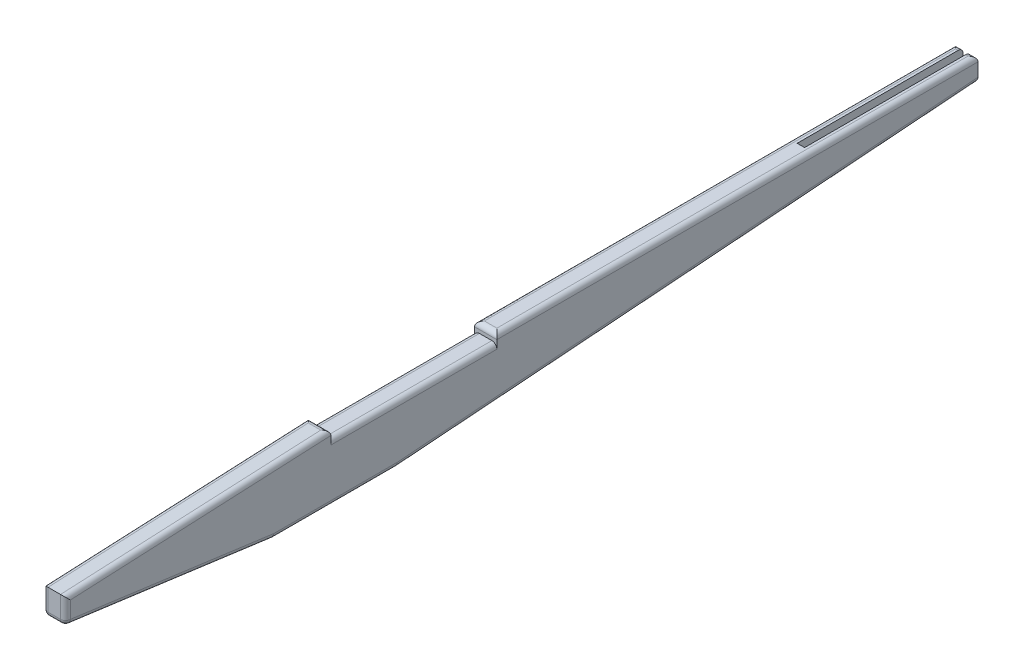
from build123d import *

# Parameters (mm, degrees)
BOSS_EXTRUDE1_DEPTH = 13.5
SKETCH2_W           = 100
SKETCH2_H           = 5
CUT_EXTRUDE1_DEPTH  = 552.61784779
SKETCH3_W           = 4.5
SKETCH3_H           = 100
CUT_EXTRUDE2_DEPTH  = 5
FILLET1_R           = 3


with BuildPart() as part:
    # Sketch1 → Boss-Extrude1 (new body)
    with BuildSketch(Plane(origin=(0, 0, 0), x_dir=(0, 0, -1), z_dir=(1, 0, 0))):
        Polygon((0, 16.9), (0, 32.5), (160, 40), (550, 40), (550, 26), (200, 0), (125.3, 0), align=None)
    extrude(amount=BOSS_EXTRUDE1_DEPTH)

    # Sketch2 → Cut-Extrude1 (cut, through all)
    with BuildSketch(Plane(origin=(13.5, 0, 0), x_dir=(0, 0, -1), z_dir=(1, 0, 0))):
        with Locations((210, 37.5)):
            Rectangle(SKETCH2_W, SKETCH2_H)
    extrude(amount=-CUT_EXTRUDE1_DEPTH, mode=Mode.SUBTRACT)

    # Sketch3 → Cut-Extrude2 (cut)
    with BuildSketch(Plane(origin=(0, 40, 0), x_dir=(1, 0, 0), z_dir=(0, 1, 0))):
        with Locations((6.75, 500)):
            Rectangle(SKETCH3_W, SKETCH3_H)
    extrude(amount=-CUT_EXTRUDE2_DEPTH, mode=Mode.SUBTRACT)

    # Fillet1
    # the kernel refuses this fillet: 3 mm, written as the material it takes off along each edge
    with BuildSketch(Plane(origin=(10.5, 3, -125.501402614), x_dir=(0, -1, 0), z_dir=(1, 0, 0))) as fillet1_piece_1_section:
        Polygon((0, 0), (FILLET1_R, 0), (FILLET1_R, -FILLET1_R * 0.0671342046123), (FILLET1_R * 0.991026440985, -FILLET1_R * 0.133665976478), align=None)
    fillet1_piece_1 = extrude(amount=FILLET1_R, mode=Mode.PRIVATE)
    fillet1_piece_1 = fillet1_piece_1 - Plane(origin=(10.5, 3, -125.501402614), x_dir=(0, 0.9977540881864227, -0.0669834271091007), z_dir=(1, 0, 0)) * Sphere(FILLET1_R, mode=Mode.PRIVATE)
    add(fillet1_piece_1, mode=Mode.SUBTRACT)
    with BuildSketch(Plane(origin=(10.5, 19.522535548, -3), x_dir=(0, 0, 1), z_dir=(1, 0, 0))) as fillet1_piece_2_section:
        Polygon((0, 0), (FILLET1_R, 0), (FILLET1_R, FILLET1_R * 0.874178516025), (FILLET1_R * 0.133665976478, FILLET1_R * 0.991026440985), align=None)
    fillet1_piece_2 = extrude(amount=FILLET1_R, mode=Mode.PRIVATE)
    fillet1_piece_2 = fillet1_piece_2 - Plane(origin=(10.5, 19.522535548, -3), x_dir=(0, 0.6581542461772603, -0.75288311724918), z_dir=(1, 0, 0)) * Sphere(FILLET1_R, mode=Mode.PRIVATE)
    add(fillet1_piece_2, mode=Mode.SUBTRACT)
    with BuildSketch(Plane(origin=(3, 3, -125.501402614), x_dir=(0, -1, 0), z_dir=(-1, 0, 0))) as fillet1_piece_3_section:
        Polygon((0, 0), (FILLET1_R, 0), (FILLET1_R, FILLET1_R * 0.0671342046123), (FILLET1_R * 0.991026440985, FILLET1_R * 0.133665976478), align=None)
    fillet1_piece_3 = extrude(amount=FILLET1_R, mode=Mode.PRIVATE)
    fillet1_piece_3 = fillet1_piece_3 - Plane(origin=(3, 3, -125.501402614), x_dir=(0, 0.9977540881864227, -0.0669834271091007), z_dir=(-1, 0, 0)) * Sphere(FILLET1_R, mode=Mode.PRIVATE)
    add(fillet1_piece_3, mode=Mode.SUBTRACT)
    with BuildSketch(Plane(origin=(3, 19.522535548, -3), x_dir=(0, 0, 1), z_dir=(-1, 0, 0))) as fillet1_piece_4_section:
        Polygon((0, 0), (FILLET1_R, 0), (FILLET1_R, -FILLET1_R * 0.874178516025), (FILLET1_R * 0.133665976478, -FILLET1_R * 0.991026440985), align=None)
    fillet1_piece_4 = extrude(amount=FILLET1_R, mode=Mode.PRIVATE)
    fillet1_piece_4 = fillet1_piece_4 - Plane(origin=(3, 19.522535548, -3), x_dir=(0, 0.6581542461772603, -0.75288311724918), z_dir=(-1, 0, 0)) * Sphere(FILLET1_R, mode=Mode.PRIVATE)
    add(fillet1_piece_4, mode=Mode.SUBTRACT)
    with BuildSketch(Plane(origin=(0, 32.148823103, 7.491773808), x_dir=(1, 0, 0), z_dir=(0, 0.046823586298586156, -0.998903174369838))) as fillet1_piece_5:
        with BuildLine():
            CenterArc((FILLET1_R, FILLET1_R), FILLET1_R, 180, 90)
            Line((0, FILLET1_R), (0, 0))
            Line((0, 0), (FILLET1_R, 0))
        make_face()
    extrude(amount=175.175684796, mode=Mode.SUBTRACT)
    with BuildSketch(Plane(origin=(-7.859797725, 40, -160), x_dir=(0, -0.046823586298585164, 0.998903174369838), z_dir=(1, 0, 0))) as fillet1_piece_6:
        with BuildLine():
            CenterArc((FILLET1_R * 1.04797302998, FILLET1_R), FILLET1_R, 177.316224841, 92.683775159)
            Line((FILLET1_R * 0.0490698556077, FILLET1_R * 1.0468235863), (0, 0))
            Line((0, 0), (FILLET1_R * 1.04797302998, 0))
        make_face()
    extrude(amount=29.21959545, mode=Mode.SUBTRACT)
    with BuildSketch(Plane(origin=(1.5, 40, -550), x_dir=(0, -1, 0), z_dir=(1, 0, 0)), Plane(origin=(-7.5, 40, -550), x_dir=(0, -1, 0), z_dir=(1, 0, 0))) as fillet1_piece_7:
        with BuildLine():
            CenterArc((FILLET1_R, -FILLET1_R), FILLET1_R, 90, 90)
            Line((0, -FILLET1_R), (0, 0))
            Line((0, 0), (FILLET1_R, 0))
        make_face()
    extrude(amount=19.5, mode=Mode.SUBTRACT)
    with BuildSketch(Plane(origin=(-6.96352255, 26, -550), x_dir=(0, -0.07408159078957711, 0.9972521837058496), z_dir=(1, 0, 0))) as fillet1_piece_8:
        with BuildLine():
            CenterArc((FILLET1_R * 0.928469673307, -FILLET1_R), FILLET1_R, 90, 85.751545471)
            Line((-FILLET1_R * 0.0687825103985, -FILLET1_R * 0.92591840921), (0, 0))
            Line((0, 0), (FILLET1_R * 0.928469673307, 0))
        make_face()
    extrude(amount=27.4270451, mode=Mode.SUBTRACT)
    with BuildSketch(Plane(origin=(13.5, 0.026920677, -125.100404684), x_dir=(-1, 0, 0), z_dir=(0, 0.1336659764776849, 0.9910264409854396))) as fillet1_piece_9:
        with BuildLine():
            CenterArc((FILLET1_R, -FILLET1_R), FILLET1_R, 90, 90)
            Line((0, -FILLET1_R), (0, 0))
            Line((0, 0), (FILLET1_R, 0))
        make_face()
    extrude(amount=123.610629896, mode=Mode.SUBTRACT)
    with BuildSketch(Plane(origin=(3, 0, -125.3), x_dir=(0, 0.1336659764776861, 0.9910264409854393), z_dir=(1, 0, 0))) as fillet1_piece_10:
        with BuildLine():
            CenterArc((FILLET1_R * 0.0671342046123, -FILLET1_R), FILLET1_R, 90, 7.68148685)
            Line((-FILLET1_R * 0.0665317718654, -FILLET1_R * 0.00897355901456), (0, 0))
            Line((0, 0), (FILLET1_R * 0.0671342046123, 0))
        make_face()
    extrude(amount=7.5, mode=Mode.SUBTRACT)
    with BuildSketch(Plane(origin=(3, 16.9, 0), x_dir=(0, 1, 0), z_dir=(1, 0, 0))) as fillet1_piece_11:
        with BuildLine():
            CenterArc((FILLET1_R * 0.874178516025, -FILLET1_R), FILLET1_R, 90, 82.31851315)
            Line((-FILLET1_R * 0.11684792496, -FILLET1_R * 0.866334023522), (0, 0))
            Line((0, 0), (FILLET1_R * 0.874178516025, 0))
        make_face()
    extrude(amount=7.5, mode=Mode.SUBTRACT)
    with BuildSketch(Plane(origin=(13.5, 0, -207.5), x_dir=(0, 1, 0), z_dir=(0, 0, 1))) as fillet1_piece_12:
        with BuildLine():
            CenterArc((FILLET1_R, FILLET1_R), FILLET1_R, 180, 90)
            Line((0, FILLET1_R), (0, 0))
            Line((0, 0), (FILLET1_R, 0))
        make_face()
    extrude(amount=81.998597386, mode=Mode.SUBTRACT)
    with BuildSketch(Plane(origin=(13.5, 26.555611931, -557.479391378), x_dir=(0, 0.9972521837058497, 0.07408159078957739), z_dir=(0, -0.0740815907895774, 0.9972521837058497))) as fillet1_piece_13:
        with BuildLine():
            CenterArc((FILLET1_R, FILLET1_R), FILLET1_R, 180, 90)
            Line((0, FILLET1_R), (0, 0))
            Line((0, 0), (FILLET1_R, 0))
        make_face()
    extrude(amount=365.964385658, mode=Mode.SUBTRACT)
    with BuildSketch(Plane(origin=(21, 40, -260), x_dir=(0, 0, -1), z_dir=(-1, 0, 0))) as fillet1_piece_14:
        with BuildLine():
            CenterArc((FILLET1_R, FILLET1_R), FILLET1_R, 180, 90)
            Line((0, FILLET1_R), (0, 0))
            Line((0, 0), (FILLET1_R, 0))
        make_face()
    extrude(amount=28.5, mode=Mode.SUBTRACT)
    with BuildSketch(Plane(origin=(0, 35, -160), x_dir=(0, -1, 0), z_dir=(0, 0, -1)), Plane(origin=(13.5, 35, -260), x_dir=(0, -1, 0), z_dir=(0, 0, 1))) as fillet1_piece_15:
        with BuildLine():
            CenterArc((FILLET1_R, -FILLET1_R), FILLET1_R, 90, 90)
            Line((0, -FILLET1_R), (0, 0))
            Line((0, 0), (FILLET1_R, 0))
        make_face()
    extrude(amount=100, mode=Mode.SUBTRACT)
    with BuildSketch(Plane(origin=(13.5, 40, -252.5), x_dir=(0, -1, 0), z_dir=(0, 0, -1))) as fillet1_piece_16:
        with BuildLine():
            CenterArc((FILLET1_R, FILLET1_R), FILLET1_R, 180, 90)
            Line((0, FILLET1_R), (0, 0))
            Line((0, 0), (FILLET1_R, 0))
        make_face()
    extrude(amount=305, mode=Mode.SUBTRACT)
    with BuildSketch(Plane(origin=(13.5, 32.148823103, 7.491773808), x_dir=(-1, 0, 0), z_dir=(0, 0.046823586298586156, -0.998903174369838))) as fillet1_piece_17:
        with BuildLine():
            CenterArc((FILLET1_R, -FILLET1_R), FILLET1_R, 90, 90)
            Line((0, -FILLET1_R), (0, 0))
            Line((0, 0), (FILLET1_R, 0))
        make_face()
    extrude(amount=175.175684796, mode=Mode.SUBTRACT)
    with BuildSketch(Plane(origin=(0, 40, -252.5), x_dir=(0, -1, 0), z_dir=(0, 0, -1))) as fillet1_piece_18:
        with BuildLine():
            CenterArc((FILLET1_R, -FILLET1_R), FILLET1_R, 90, 90)
            Line((0, -FILLET1_R), (0, 0))
            Line((0, 0), (FILLET1_R, 0))
        make_face()
    extrude(amount=305, mode=Mode.SUBTRACT)
    with BuildSketch(Plane(origin=(0, 26.555611931, -557.479391378), x_dir=(0, 0.9972521837058497, 0.07408159078957739), z_dir=(0, -0.0740815907895774, 0.9972521837058497))) as fillet1_piece_19:
        with BuildLine():
            CenterArc((FILLET1_R, -FILLET1_R), FILLET1_R, 90, 90)
            Line((0, -FILLET1_R), (0, 0))
            Line((0, 0), (FILLET1_R, 0))
        make_face()
    extrude(amount=365.964385658, mode=Mode.SUBTRACT)
    with BuildSketch(Plane(origin=(0, 0, -207.5), x_dir=(0, 1, 0), z_dir=(0, 0, 1))) as fillet1_piece_20:
        with BuildLine():
            CenterArc((FILLET1_R, -FILLET1_R), FILLET1_R, 90, 90)
            Line((0, -FILLET1_R), (0, 0))
            Line((0, 0), (FILLET1_R, 0))
        make_face()
    extrude(amount=81.998597386, mode=Mode.SUBTRACT)
    with BuildSketch(Plane(origin=(13.5, 19.522535548, 0), x_dir=(-1, 0, 0), z_dir=(0, 1, 0))) as fillet1_piece_21:
        with BuildLine():
            CenterArc((FILLET1_R, -FILLET1_R), FILLET1_R, 90, 90)
            Line((0, -FILLET1_R), (0, 0))
            Line((0, 0), (FILLET1_R, 0))
        make_face()
    extrude(amount=20.477464452, mode=Mode.SUBTRACT)
    with BuildSketch(Plane(origin=(0, 0.026920677, -125.100404684), x_dir=(1, 0, 0), z_dir=(0, 0.1336659764776849, 0.9910264409854396))) as fillet1_piece_22:
        with BuildLine():
            CenterArc((FILLET1_R, FILLET1_R), FILLET1_R, 180, 90)
            Line((0, FILLET1_R), (0, 0))
            Line((0, 0), (FILLET1_R, 0))
        make_face()
    extrude(amount=123.610629896, mode=Mode.SUBTRACT)
    with BuildSketch(Plane(origin=(0, 19.522535548, 0), x_dir=(1, 0, 0), z_dir=(0, 1, 0))) as fillet1_piece_23:
        with BuildLine():
            CenterArc((FILLET1_R, FILLET1_R), FILLET1_R, 180, 90)
            Line((0, FILLET1_R), (0, 0))
            Line((0, 0), (FILLET1_R, 0))
        make_face()
    extrude(amount=20.477464452, mode=Mode.SUBTRACT)


solid = part.part
